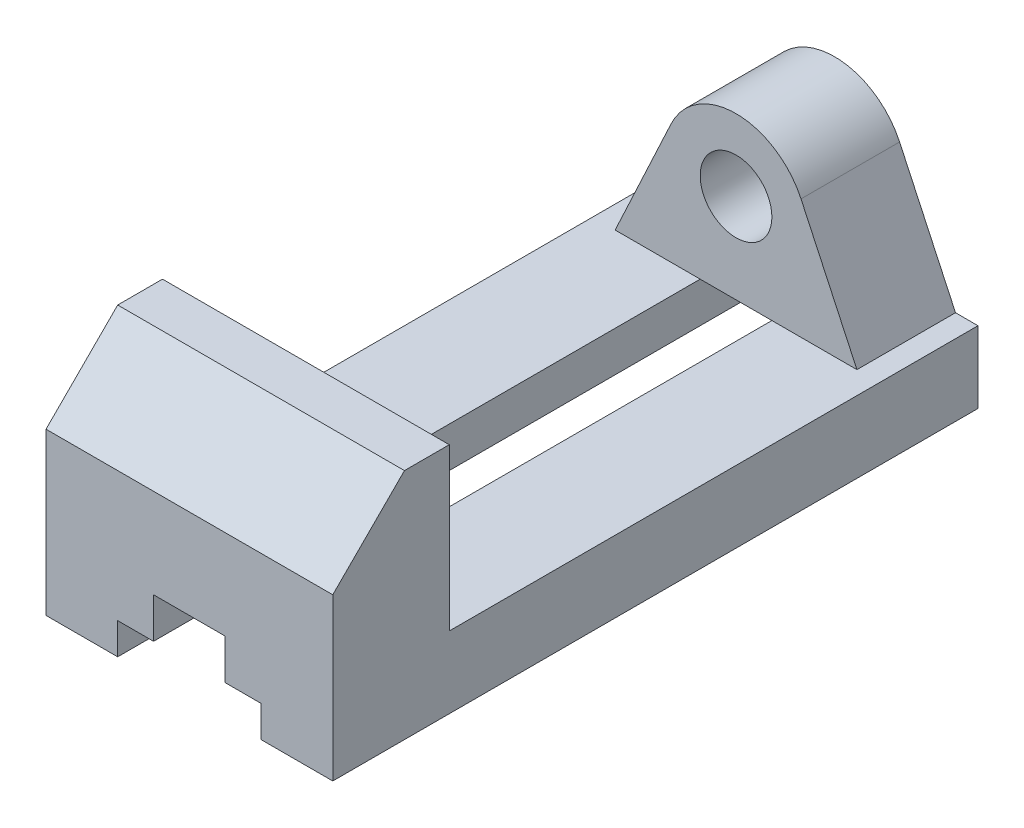
from build123d import *

# Parameters (mm, degrees)
BOSS_EXTRUDE2_DEPTH   = 144
BOSS_EXTRUDE2_2_DEPTH = 144
BOSS_EXTRUDE3_START   = 118
BOSS_EXTRUDE3_DEPTH   = 26
BOSS_EXTRUDE4_DEPTH   = 22
CHAMFER1_SIZE         = 16


# Read off the part's stored shape, not the designer's step: Ø2.0 (6) Diameter Hole1
with BuildPart() as part:
    # Sketch1 → Boss-Extrude2 (new body)
    with BuildSketch(Plane.XY):
        Polygon((26.980199866, -10), (8, -10), (8, -19), (16, -19), (16, -26), (32, -26), (32, -10), align=None)
    extrude(amount=BOSS_EXTRUDE2_DEPTH)



with BuildPart() as body_2:
    # Sketch1 → Boss-Extrude2 2 (new body)
    with BuildSketch(Plane.XY):
        Polygon((-32, -10), (-32, -26), (-16, -26), (-16, -19), (-8, -19), (-8, -10), (-26.980199866, -10), align=None)
    extrude(amount=BOSS_EXTRUDE2_2_DEPTH)


with BuildPart() as part_1:
    add(part.part)

    add(body_2.part)  # Boss-Extrude3 merges body 2
    # Sketch1<5> → Boss-Extrude3 (add)
    with BuildSketch(Plane.XY.offset(BOSS_EXTRUDE3_START)):
        Polygon((17.654046703, 10), (26.980199866, -10), (32, -10), (32, 10), align=None)
        with BuildLine():
            Line((32, 26), (-2.1e-08, 26))
            ThreePointArc((-2.1e-08, 26), (8.596793725, 23.494263139), (14.500924593, 16.761892188))
            Line((14.500924593, 16.761892188), (17.654046703, 10))
            Line((17.654046703, 10), (32, 10))
            Line((32, 10), (32, 26))
        make_face()
        with BuildLine():
            Line((-32, 26), (-32, 10))
            Line((-32, 10), (-17.654046703, 10))
            Line((-17.654046703, 10), (-14.500924593, 16.761892188))
            ThreePointArc((-14.500924593, 16.761892188), (-8.596793742, 23.494263127), (-2.1e-08, 26))
            Line((-2.1e-08, 26), (-32, 26))
        make_face()
        with BuildLine():
            Line((-14.500924593, 16.761892188), (-17.654046703, 10))
            Line((-17.654046703, 10), (-8, 10))
            ThreePointArc((-8, 10), (0, 18), (8, 10))
            Line((8, 10), (17.654046703, 10))
            Line((17.654046703, 10), (14.500924593, 16.761892188))
            ThreePointArc((14.500924593, 16.761892188), (8.596793725, 23.494263139), (-2.1e-08, 26))
            ThreePointArc((-2.1e-08, 26), (-8.596793742, 23.494263127), (-14.500924593, 16.761892188))
        make_face()
        with BuildLine():
            Line((-17.654046703, 10), (-26.980199866, -10))
            Line((-26.980199866, -10), (-8, -10))
            Line((-8, -10), (8, -10))
            Line((8, -10), (26.980199866, -10))
            Line((26.980199866, -10), (17.654046703, 10))
            Line((17.654046703, 10), (8, 10))
            ThreePointArc((8, 10), (0, 2), (-8, 10))
            Line((-8, 10), (-17.654046703, 10))
        make_face()
        with BuildLine():
            ThreePointArc((8, 10), (0, 18), (-8, 10))
            Line((-8, 10), (8, 10))
        make_face()
        with BuildLine():
            Line((8, 10), (-8, 10))
            ThreePointArc((-8, 10), (0, 2), (8, 10))
        make_face()
        Polygon((-32, 10), (-32, -10), (-26.980199866, -10), (-17.654046703, 10), align=None)
        Polygon((-32, -10), (-32, -26), (-16, -26), (-16, -19), (-8, -19), (-8, -10), (-26.980199866, -10), align=None)
        Polygon((26.980199866, -10), (8, -10), (8, -19), (16, -19), (16, -26), (32, -26), (32, -10), align=None)
    extrude(amount=BOSS_EXTRUDE3_DEPTH)

    # Sketch1<6> → Boss-Extrude4 (add)
    with BuildSketch(Plane.XY):
        with BuildLine():
            Line((-17.654046703, 10), (-26.980199866, -10))
            Line((-26.980199866, -10), (-8, -10))
            Line((-8, -10), (8, -10))
            Line((8, -10), (26.980199866, -10))
            Line((26.980199866, -10), (17.654046703, 10))
            Line((17.654046703, 10), (8, 10))
            ThreePointArc((8, 10), (0, 2), (-8, 10))
            Line((-8, 10), (-17.654046703, 10))
        make_face()
        with BuildLine():
            Line((-14.500924593, 16.761892188), (-17.654046703, 10))
            Line((-17.654046703, 10), (-8, 10))
            ThreePointArc((-8, 10), (0, 18), (8, 10))
            Line((8, 10), (17.654046703, 10))
            Line((17.654046703, 10), (14.500924593, 16.761892188))
            ThreePointArc((14.500924593, 16.761892188), (8.596793725, 23.494263139), (-2.1e-08, 26))
            ThreePointArc((-2.1e-08, 26), (-8.596793742, 23.494263127), (-14.500924593, 16.761892188))
        make_face()
    extrude(amount=BOSS_EXTRUDE4_DEPTH)

    # Chamfer1
    chamfer1_edges = [part_1.edges().sort_by_distance(p)[0] for p in [
        (0, 26, 144),
    ]]
    chamfer(chamfer1_edges, length=CHAMFER1_SIZE)

    # Ø2.0 (6) Diameter Hole1 outline → Ø2.0 (6) Diameter Hole1 (revolve, cut)
    with BuildSketch(Plane(origin=(-22, 0, 38), x_dir=(1, 0, 0), z_dir=(0, 0, 1))):
        Polygon((3, -16), (0, -14.267949192), (0, -26), (3, -26), align=None)
    revolve(axis=Axis((-22, 0, 38), (0, 1, 0)), mode=Mode.SUBTRACT)

    # 2.0 _6_ Diameter Hole1 2 outline → 2.0 _6_ Diameter Hole1 2 (revolve, cut)
    with BuildSketch(Plane(origin=(22, 0, 108), x_dir=(1, 0, 0), z_dir=(0, 0, 1))):
        Polygon((3, -16), (0, -14.267949192), (0, -26), (3, -26), align=None)
    revolve(axis=Axis((22, 0, 108), (0, 1, 0)), mode=Mode.SUBTRACT)

    # 2.0 _6_ Diameter Hole1 3 outline → 2.0 _6_ Diameter Hole1 3 (revolve, cut)
    with BuildSketch(Plane(origin=(-22, 0, 108), x_dir=(1, 0, 0), z_dir=(0, 0, 1))):
        Polygon((3, -16), (0, -14.267949192), (0, -26), (3, -26), align=None)
    revolve(axis=Axis((-22, 0, 108), (0, 1, 0)), mode=Mode.SUBTRACT)

    # 2.0 _6_ Diameter Hole1 4 outline → 2.0 _6_ Diameter Hole1 4 (revolve, cut)
    with BuildSketch(Plane(origin=(22, 0, 38), x_dir=(1, 0, 0), z_dir=(0, 0, 1))):
        Polygon((3, -16), (0, -14.267949192), (0, -26), (3, -26), align=None)
    revolve(axis=Axis((22, 0, 38), (0, 1, 0)), mode=Mode.SUBTRACT)


solid = part_1.part
